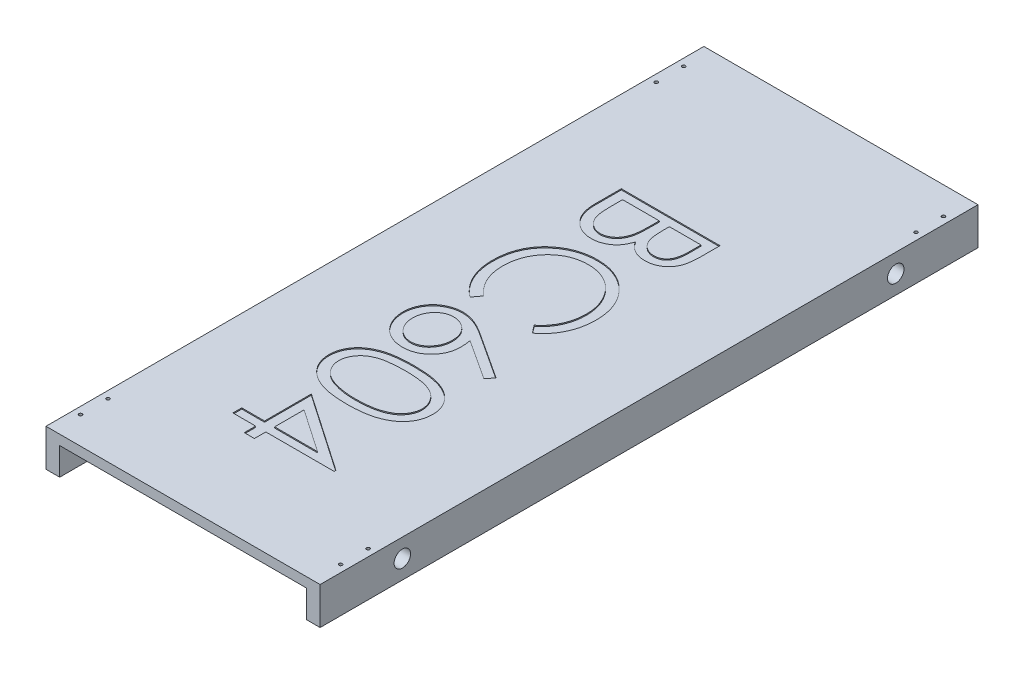
from build123d import *

# Parameters (mm, degrees)
BOSS_EXTRUDE1_DEPTH               = 1200
CUT_EXTRUDE1_DEPTH                = 1239.388983667
CUT_EXTRUDE1_DEPTH_BACK           = 1239.388983667
SKETCH4_R                         = 15
CUT_EXTRUDE2_DEPTH                = 1239.388983667
CUT_EXTRUDE2_DEPTH_BACK           = 1239.388983667
SKETCH4_3_R                       = 15
CUT_EXTRUDE3_DEPTH                = 2
CUT_EXTRUDE4_DEPTH                = 2
F_6_0_6_DIAMETER_HOLE1_AT_2_COUNT = 2
F_6_0_6_DIAMETER_HOLE1_AT_2_PITCH = 476.629835407
F_6_0_6_DIAMETER_HOLE1_AT_3_COUNT = 2
F_6_0_6_DIAMETER_HOLE1_AT_3_PITCH = 474
F_6_0_6_DIAMETER_HOLE1_AT_4_COUNT = 2
F_6_0_6_DIAMETER_HOLE1_AT_4_PITCH = 1151.627596978
F_6_0_6_DIAMETER_HOLE1_AT_5_COUNT = 2
F_6_0_6_DIAMETER_HOLE1_AT_5_PITCH = 1106.250609654
F_6_0_6_DIAMETER_HOLE1_AT_6_COUNT = 2
F_6_0_6_DIAMETER_HOLE1_AT_6_PITCH = 1050
F_6_0_6_DIAMETER_HOLE1_AT_7_COUNT = 2
F_6_0_6_DIAMETER_HOLE1_AT_7_PITCH = 1000
F_6_0_6_DIAMETER_HOLE1_AT_8_COUNT = 2
F_6_0_6_DIAMETER_HOLE1_AT_8_PITCH = 50


with BuildPart() as part:
    # Sketch2 → Boss-Extrude1 (new body)
    with BuildSketch(Plane.XY):
        Polygon((-251.282051282, 174.541128592), (248.717948718, 174.541128592), (248.717948718, 156.541128592), (248.717948718, 106.541128592), (223.717948718, 106.541128592), (223.717948718, 156.541128592), (-226.282051282, 156.541128592), (-226.282051282, 106.541128592), (-251.282051282, 106.541128592), (-251.282051282, 156.541128592), align=None)
    extrude(amount=BOSS_EXTRUDE1_DEPTH)

    # Sketch4 → Cut-Extrude1 (cut, two sides: drawn at the far end of the back side and taken through both)
    with BuildSketch(Plane(origin=(0, 0, 0), x_dir=(0, 0, -1), z_dir=(1, 0, 0)).offset(-CUT_EXTRUDE1_DEPTH_BACK)):
        with Locations((-1050, 140.541128592)):
            Circle(SKETCH4_R)
    extrude(amount=CUT_EXTRUDE1_DEPTH + CUT_EXTRUDE1_DEPTH_BACK, mode=Mode.SUBTRACT)

    # Sketch4<3> → Cut-Extrude2 (cut, two sides: drawn at the far end of the back side and taken through both)
    with BuildSketch(Plane(origin=(0, 0, 0), x_dir=(0, 0, -1), z_dir=(1, 0, 0)).offset(-CUT_EXTRUDE2_DEPTH_BACK)):
        with Locations((-150, 140.541128592)):
            Circle(SKETCH4_3_R)
    extrude(amount=CUT_EXTRUDE2_DEPTH + CUT_EXTRUDE2_DEPTH_BACK, mode=Mode.SUBTRACT)

    # Sketch10 → Cut-Extrude3 (cut)
    # profile 1 of 5: a face of its own
    with BuildSketch(Plane(origin=(0, 174.541128592, 0), x_dir=(1, 0, 0), z_dir=(0, 1, 0))):
        with BuildLine():
            Line((78.146190481, -300.04491907), (78.146190481, -335.165111378))
            add(Edge.make_bspline(
                [(78.146190481, -335.165111378), (78.137151889, -336.884290256), (78.119632848, -340.216486787), (77.84792896, -345.062058082), (77.477454509, -349.600568343), (76.889621173, -353.833333778), (76.180329777, -357.758398473), (75.321379235, -361.387591245), (74.291439104, -364.709371533), (72.653630355, -368.675169405), (70.219867411, -373.196803393), (66.623541204, -378.092720732), (62.224728815, -382.279224471), (57.262763679, -385.8888065), (51.80435256, -388.758578366), (45.97959428, -390.834713657), (39.863618981, -392.149118675), (35.664826976, -392.284295292), (33.542825096, -392.352611378)],
                knots=[0, 0, 0, 0, 1.001505555, 1.941167018, 2.826882275, 3.653841531, 4.429895133, 5.150066043, 5.825578002, 6.45369114, 7.647487171, 8.808567382, 9.977351308, 11.170798116, 12.373658725, 13.556498008, 14.765093433, 16, 16, 16, 16], degree=3))
            add(Edge.make_bspline(
                [(33.542825096, -392.352611378), (31.554642564, -392.297475334), (27.647676393, -392.189127808), (21.942511139, -391.117785689), (16.489305649, -389.522710094), (11.355286662, -387.20713163), (6.606437457, -384.228581148), (2.270980235, -380.644239428), (-1.546018812, -376.376612054), (-3.671033142, -373.174069448), (-4.750444135, -371.547322916)],
                knots=[0, 0, 0, 0, 1.044266239, 2.052081639, 3.041743201, 4.026043445, 5.00270663, 5.980942822, 6.97441044, 8, 8, 8, 8], degree=3))
            add(Edge.make_bspline(
                [(-4.750444135, -371.547322916), (-5.534895397, -373.592487364), (-7.035744986, -377.505393579), (-9.703667422, -382.8939412), (-12.572726976, -387.555154482), (-15.722466917, -391.494164039), (-19.160007854, -394.812170025), (-22.81651492, -397.791808261), (-26.872003078, -400.288077055), (-31.210995112, -402.432582364), (-35.803037831, -404.120285559), (-40.627130054, -405.314446312), (-45.629329694, -406.048199974), (-49.038837045, -406.148254614), (-50.760059519, -406.198765224)],
                knots=[0, 0, 0, 0, 1.272302504, 2.434229863, 3.488457646, 4.447234501, 5.35599188, 6.26022912, 7.18267843, 8.11661068, 9.06895546, 10.019249207, 11.000057067, 12, 12, 12, 12], degree=3))
            add(Edge.make_bspline(
                [(-50.760059519, -406.198765224), (-52.517202979, -406.148511661), (-55.974431963, -406.049636369), (-61.053409765, -405.320605874), (-65.906455435, -404.085024166), (-70.568074829, -402.387267407), (-75.01188155, -400.158891413), (-79.293530547, -397.505476298), (-83.298961583, -394.275933825), (-87.123428233, -390.676151579), (-90.560058808, -386.59901095), (-93.619614283, -382.200733576), (-96.147328006, -377.418057754), (-98.244128296, -372.325150131), (-99.869137809, -366.888168175), (-100.997294776, -361.127270907), (-101.75921832, -355.041206432), (-101.821744111, -350.864674882), (-101.853809519, -348.722803685)],
                knots=[0, 0, 0, 0, 0.978404568, 1.925038397, 2.85041836, 3.763147166, 4.682162379, 5.614488577, 6.562659439, 7.54271123, 8.535210642, 9.526693784, 10.520907202, 11.541451354, 12.589717429, 13.675358278, 14.807842563, 16, 16, 16, 16], degree=3))
            Line((-101.853809519, -348.722803685), (-101.853809519, -300.04491907))
            Line((-101.853809519, -300.04491907), (78.146190481, -300.04491907))
        make_face()
        with BuildLine():
            Line((59.684652019, -316.198765224), (1.992344327, -316.198765224))
            Line((1.992344327, -316.198765224), (1.992344327, -327.052130608))
            add(Edge.make_bspline(
                [(1.992344327, -327.052130608), (2.012740642, -328.63865437), (2.05215048, -331.704141593), (2.168599084, -336.155247993), (2.480381589, -340.276595815), (2.810143025, -344.082386479), (3.317908156, -347.547111925), (3.939270014, -350.682371106), (4.590672086, -353.516328478), (5.701591112, -356.783018278), (7.326766392, -360.487401204), (9.908212222, -364.411314459), (12.899379515, -367.926728046), (16.414448564, -370.862054075), (20.252125245, -373.284211145), (24.412751665, -374.90065365), (28.733898368, -376.047175078), (31.708191118, -376.147717563), (33.218305865, -376.198765224)],
                knots=[0, 0, 0, 0, 1.156481963, 2.23455883, 3.244418989, 4.168404366, 5.01828131, 5.794834307, 6.498111525, 7.13526334, 8.307595709, 9.435046769, 10.546766856, 11.659452936, 12.760769924, 13.837671619, 14.902137667, 16, 16, 16, 16], degree=3))
            add(Edge.make_bspline(
                [(33.218305865, -376.198765224), (34.217816075, -376.173234142), (36.178464499, -376.123152137), (39.025629028, -375.667346349), (41.737653684, -375.005967717), (44.25216376, -373.972692522), (46.640628838, -372.72324923), (48.796961191, -371.097950265), (50.839297556, -369.262436648), (52.692648407, -367.106804568), (54.353258025, -364.641491722), (55.814448831, -361.843008211), (56.967077926, -358.677938688), (58.001047584, -355.218047551), (58.718509843, -351.407962296), (59.318403841, -347.28491266), (59.623346562, -342.813921557), (59.663761065, -339.720753874), (59.684652019, -338.121842147)],
                knots=[0, 0, 0, 0, 0.911752476, 1.788502045, 2.626783689, 3.45400582, 4.26402138, 5.080402872, 5.911472738, 6.767166405, 7.66795952, 8.620018292, 9.640966946, 10.73819047, 11.913090943, 13.176185384, 14.540321519, 16, 16, 16, 16], degree=3))
            Line((59.684652019, -338.121842147), (59.684652019, -316.198765224))
        make_face(mode=Mode.SUBTRACT)
        with BuildLine():
            Line((-16.469194135, -316.198765224), (-83.392271058, -316.198765224))
            Line((-83.392271058, -316.198765224), (-83.392271058, -339.203572916))
            add(Edge.make_bspline(
                [(-83.392271058, -339.203572916), (-83.372604407, -340.850268699), (-83.33469953, -344.024057733), (-83.20960499, -348.606298043), (-82.931038039, -352.84187125), (-82.476899615, -356.733214658), (-82.005010221, -360.31458269), (-81.351892482, -363.550394358), (-80.60937658, -366.445610416), (-79.460298051, -369.802260223), (-77.678231305, -373.58449046), (-74.97375424, -377.657571628), (-71.79421265, -381.315031314), (-68.067907037, -384.385285533), (-64.046862306, -386.920581078), (-59.752109883, -388.698731772), (-55.31466984, -389.842057189), (-52.28131926, -389.977162316), (-50.760059519, -390.04491907)],
                knots=[0, 0, 0, 0, 1.159821618, 2.235403267, 3.228114831, 4.14795534, 4.994323282, 5.771256229, 6.471395042, 7.097801288, 8.267864287, 9.404187171, 10.531774336, 11.667624178, 12.792825787, 13.866573821, 14.930062559, 16, 16, 16, 16], degree=3))
            add(Edge.make_bspline(
                [(-50.760059519, -390.04491907), (-49.808850388, -390.0310698), (-47.921775214, -390.003594651), (-45.150755565, -389.573654821), (-42.454582343, -388.973860711), (-39.87402563, -388.105307285), (-37.367094245, -387.010131795), (-34.977455008, -385.635728108), (-32.647970771, -384.04855224), (-29.706360083, -381.565684728), (-26.315971326, -377.957718928), (-22.997023822, -372.829647938), (-20.320244429, -366.999155628), (-19.183704921, -362.770301313), (-18.596597981, -360.585784455)],
                knots=[0, 0, 0, 0, 0.723503378, 1.435336582, 2.130201219, 2.824764462, 3.504949994, 4.209866579, 4.920640069, 5.648298893, 7.13757748, 8.670694625, 10.280166878, 12, 12, 12, 12], degree=3))
            add(Edge.make_bspline(
                [(-18.596597981, -360.585784455), (-18.418896005, -359.7100032), (-18.033601468, -357.811128796), (-17.627149259, -354.714723215), (-17.262548395, -351.167882191), (-16.999933916, -347.185765547), (-16.718021857, -342.752535892), (-16.612287641, -337.869617446), (-16.483233445, -332.533558181), (-16.473993617, -328.831088783), (-16.469194135, -326.907899839)],
                knots=[0, 0, 0, 0, 0.634452549, 1.375623993, 2.216454381, 3.166361212, 4.209414599, 5.370755378, 6.634280627, 8, 8, 8, 8], degree=3))
            Line((-16.469194135, -326.907899839), (-16.469194135, -316.198765224))
        make_face(mode=Mode.SUBTRACT)
    # profile 2 of 5: a face of its own
    with BuildSketch(Plane(origin=(0, 174.541128592, 0), x_dir=(1, 0, 0), z_dir=(0, 1, 0))):
        with BuildLine():
            Line((45.117344327, -609.275688301), (34.300036634, -595.141072916))
            add(Edge.make_bspline(
                [(34.300036634, -595.141072916), (35.501715083, -594.132770086), (37.888870749, -592.129758535), (41.240961607, -588.907285263), (44.381460766, -585.548915057), (47.325328862, -582.05593168), (49.969619671, -578.365462678), (52.452133536, -574.566907318), (54.677331488, -570.596722136), (57.375427917, -565.106632925), (60.19094446, -557.924743585), (62.55168207, -548.883866147), (64.054485391, -539.446152511), (64.217248666, -533.007418816), (64.300036634, -529.73241907)],
                knots=[0, 0, 0, 0, 0.757959112, 1.505699292, 2.245454638, 2.979532153, 3.711538275, 4.438200793, 5.171680507, 5.909471876, 7.393775596, 8.890124382, 10.418191784, 12, 12, 12, 12], degree=3))
            add(Edge.make_bspline(
                [(64.300036634, -529.73241907), (64.279167677, -527.928157036), (64.237623446, -524.33637822), (63.693394735, -519.005561632), (62.919665439, -513.764191366), (61.799531636, -508.631758221), (60.34121905, -503.618452877), (58.631007645, -498.686103166), (56.502823112, -493.892799003), (54.15252742, -489.180854209), (51.497125227, -484.666703207), (48.601683077, -480.394635806), (45.494619312, -476.38416906), (42.183954184, -472.624189863), (38.628542794, -469.155934515), (34.870210343, -465.923819049), (30.863720628, -462.986093805), (26.684211993, -460.270569302), (22.325541372, -457.854238175), (17.815128438, -455.767619253), (13.170218131, -453.979213346), (8.381295054, -452.550972436), (3.467204783, -451.424429607), (-1.582481489, -450.646162626), (-6.757962051, -450.106829751), (-10.2658649, -450.065667685), (-12.034097981, -450.04491907)],
                knots=[0, 0, 0, 0, 1.055000685, 2.100209969, 3.131349012, 4.153242145, 5.170189196, 6.184191144, 7.204341339, 8.235672124, 9.263040994, 10.265373269, 11.252624173, 12.22887325, 13.193405896, 14.155809299, 15.126090485, 16.097288279, 17.069732292, 18.038585918, 19.002221264, 19.978698174, 20.959418239, 21.948869816, 22.966084182, 24, 24, 24, 24], degree=3))
            add(Edge.make_bspline(
                [(-12.034097981, -450.04491907), (-14.694565863, -450.10981262), (-19.918041655, -450.237222497), (-27.569101626, -451.371136821), (-34.898736277, -453.094255802), (-41.861128167, -455.676771187), (-48.542129439, -458.861179502), (-54.828699043, -462.884982379), (-60.815836646, -467.545261443), (-66.362045388, -472.907945873), (-71.428465546, -478.791673552), (-75.889924023, -485.104423291), (-79.608975122, -491.830472377), (-82.703738085, -498.895556216), (-85.082655508, -506.354042074), (-86.757381859, -514.192517627), (-87.849836859, -522.393934526), (-87.954426531, -527.998075091), (-88.007655673, -530.850207531)],
                knots=[0, 0, 0, 0, 1.029171465, 2.020641659, 2.987623507, 3.938342917, 4.889210282, 5.84687017, 6.821220943, 7.821438502, 8.827599549, 9.822697543, 10.807740252, 11.797342354, 12.80366471, 13.83203677, 14.896651826, 16, 16, 16, 16], degree=3))
            add(Edge.make_bspline(
                [(-88.007655673, -530.850207531), (-87.920804143, -533.992631537), (-87.749859555, -540.17767371), (-86.301669601, -549.24802935), (-83.953548112, -557.931011583), (-80.66736925, -566.227087462), (-76.395440158, -574.112869267), (-71.216692177, -581.600697511), (-65.081863635, -588.696892566), (-60.397588467, -592.963987081), (-58.007655673, -595.141072916)],
                knots=[0, 0, 0, 0, 1.028121516, 2.023589091, 2.998037872, 3.967518031, 4.937445131, 5.927275754, 6.942489185, 8, 8, 8, 8], degree=3))
            Line((-58.007655673, -595.141072916), (-68.716790289, -609.275688301))
            add(Edge.make_bspline(
                [(-68.716790289, -609.275688301), (-70.18448461, -608.138187017), (-73.112843081, -605.868633016), (-77.241065231, -602.193626891), (-81.12426891, -598.322306683), (-84.730315127, -594.225416046), (-88.134483836, -589.951953824), (-91.222653001, -585.426645115), (-94.088893191, -580.727650794), (-96.67865269, -575.827612616), (-99.000656278, -570.742618054), (-100.960955906, -565.477958976), (-102.673892145, -560.078237869), (-104.07378911, -554.540735401), (-105.168174621, -548.846952304), (-105.899350278, -543.016424078), (-106.40039593, -537.036843103), (-106.446055673, -533.00271115), (-106.469194135, -530.958380608)],
                knots=[0, 0, 0, 0, 0.986756325, 1.968786143, 2.935506311, 3.899499537, 4.868307269, 5.8376204, 6.809456583, 7.792545619, 8.781780509, 9.778496008, 10.776623214, 11.79151764, 12.812666265, 13.856269958, 14.913646641, 16, 16, 16, 16], degree=3))
            add(Edge.make_bspline(
                [(-106.469194135, -530.958380608), (-106.455720232, -529.022420588), (-106.429077257, -525.194299383), (-105.997480076, -519.542363586), (-105.408636464, -514.040042288), (-104.522001152, -508.703061529), (-103.475720806, -503.502297098), (-102.073199037, -498.48489561), (-100.502099041, -493.601484791), (-98.655556865, -488.871684413), (-96.571867478, -484.29147128), (-94.21687302, -479.875618124), (-91.610377123, -475.626155887), (-88.80983373, -471.501305671), (-85.725286776, -467.562001368), (-82.399574145, -463.774105779), (-78.84390502, -460.11637843), (-76.279941134, -457.853383201), (-74.99082875, -456.715592147)],
                knots=[0, 0, 0, 0, 1.114604814, 2.203992996, 3.262667896, 4.300477797, 5.318619304, 6.316056647, 7.298880507, 8.271930387, 9.238335007, 10.195173496, 11.151986948, 12.108099108, 13.064862484, 14.031167946, 15.010108607, 16, 16, 16, 16], degree=3))
            add(Edge.make_bspline(
                [(-74.99082875, -456.715592147), (-72.751567606, -454.893187624), (-68.300079642, -451.270380244), (-61.085372034, -446.63534509), (-53.552721292, -442.667756537), (-45.662553526, -439.459852039), (-37.432573611, -436.952054334), (-28.85863287, -435.21473573), (-19.9487387, -434.085796071), (-13.888560997, -433.956695506), (-10.808136442, -433.891072916)],
                knots=[0, 0, 0, 0, 0.994628077, 1.977248131, 2.950237994, 3.925870899, 4.908910175, 5.911660606, 6.938484602, 8, 8, 8, 8], degree=3))
            add(Edge.make_bspline(
                [(-10.808136442, -433.891072916), (-7.570562862, -433.971412034), (-1.200838964, -434.129474233), (8.149469143, -435.461295021), (17.094834897, -437.629756552), (25.669677939, -440.61574253), (33.824936266, -444.555056397), (41.595052984, -449.323914415), (48.973683569, -454.968896804), (55.866491537, -461.419107975), (62.168347484, -468.494372232), (67.712710432, -476.070670924), (72.326742537, -484.133768177), (76.183691139, -492.594679369), (79.148262686, -501.516802008), (81.223569662, -510.881089047), (82.515307007, -520.669947664), (82.678603422, -527.348586678), (82.761575096, -530.742034455)],
                knots=[0, 0, 0, 0, 1.032901378, 2.032168977, 3.007206631, 3.966850309, 4.924221947, 5.891988639, 6.871730993, 7.884084801, 8.900290346, 9.89161143, 10.874607481, 11.860025555, 12.854717796, 13.869097222, 14.917278314, 16, 16, 16, 16], degree=3))
            add(Edge.make_bspline(
                [(82.761575096, -530.742034455), (82.736797947, -532.81021135), (82.687754075, -536.903959231), (82.208883891, -542.959751189), (81.412028747, -548.855858238), (80.320283323, -554.606539297), (78.982169408, -560.232647513), (77.230474882, -565.67646323), (75.196328111, -570.967630063), (72.913290121, -576.110110809), (70.303254603, -581.047956815), (67.468482434, -585.780269476), (64.3435376, -590.249962094), (61.031730866, -594.541109885), (57.409178914, -598.557105531), (53.593852962, -602.412644874), (49.472538922, -605.974543062), (46.571733337, -608.173292242), (45.117344327, -609.275688301)],
                knots=[0, 0, 0, 0, 1.096705196, 2.170817488, 3.219277236, 4.250701065, 5.274195539, 6.284202015, 7.28098643, 8.279664616, 9.266225751, 10.241373748, 11.203306326, 12.157093976, 13.114198862, 14.069774147, 15.032234603, 16, 16, 16, 16], degree=3))
        make_face()
    # profile 3 of 5: a face of its own
    with BuildSketch(Plane(origin=(0, 174.541128592, 0), x_dir=(1, 0, 0), z_dir=(0, 1, 0))):
        with BuildLine():
            Line((82.761575096, -713.121842147), (72.989940481, -725.561745993))
            Line((72.989940481, -725.561745993), (0.261575096, -678.001649839))
            add(Edge.make_bspline(
                [(0.261575096, -678.001649839), (0.76628793, -681.168121227), (1.750787378, -687.34468169), (1.913196001, -693.596642185), (1.992344327, -696.643476762)],
                knots=[0, 0, 0, 0, 1.025318673, 2, 2, 2, 2], degree=3))
            add(Edge.make_bspline(
                [(1.992344327, -696.643476762), (1.943172868, -698.472919431), (1.846380315, -702.074122883), (1.101496565, -707.361329852), (-0.072366334, -712.441903702), (-1.783510925, -717.294786618), (-3.969346293, -721.937397114), (-6.589059621, -726.396377485), (-9.777923182, -730.587909433), (-13.340120908, -734.565970078), (-17.285565825, -738.177649373), (-21.471920285, -741.375275087), (-25.894822736, -744.061224376), (-30.552032984, -746.240454631), (-35.436372047, -747.93270553), (-40.541590649, -749.166355847), (-45.871209181, -749.895592049), (-49.495801052, -749.994617286), (-51.336982596, -750.04491907)],
                knots=[0, 0, 0, 0, 1.04369286, 2.054478336, 3.041073146, 4.015093852, 4.984733326, 5.965804835, 6.960378782, 7.985147595, 9.009457201, 10.008161701, 10.986880575, 11.956520048, 12.937015923, 13.931873656, 14.949455224, 16, 16, 16, 16], degree=3))
            add(Edge.make_bspline(
                [(-51.336982596, -750.04491907), (-53.854441391, -749.95098331), (-58.805283657, -749.766248952), (-66.046293554, -748.421461292), (-72.88928098, -746.100658257), (-79.361137747, -742.995702095), (-85.273564803, -738.967265621), (-90.616813447, -734.193346918), (-95.274239575, -728.628819109), (-99.269651438, -722.405451441), (-102.444001132, -715.669834905), (-104.790862653, -708.607320642), (-106.193172054, -701.278275212), (-106.376763565, -696.30084495), (-106.469194135, -693.79491907)],
                knots=[0, 0, 0, 0, 1.031881447, 2.029301251, 3.006342947, 3.987068354, 4.962916383, 5.929513747, 6.915671209, 7.928552063, 8.953527267, 9.960179832, 10.973036711, 12, 12, 12, 12], degree=3))
            add(Edge.make_bspline(
                [(-106.469194135, -693.79491907), (-106.390600895, -691.372802569), (-106.234921447, -686.575013861), (-104.848098883, -679.517334131), (-102.600316013, -672.735781665), (-99.503540328, -666.27802514), (-95.592145916, -660.295460062), (-90.882661509, -654.944848052), (-85.479172119, -650.244805011), (-79.365101818, -646.35400093), (-72.83744487, -643.182985044), (-65.968931821, -640.946421684), (-58.897794221, -639.500030322), (-54.084387944, -639.350803448), (-51.661501827, -639.275688301)],
                knots=[0, 0, 0, 0, 1.011913813, 2.004424092, 2.994488568, 3.992479987, 4.990471406, 5.973328987, 6.963763268, 7.974390938, 8.994854117, 9.989689954, 10.988086187, 12, 12, 12, 12], degree=3))
            add(Edge.make_bspline(
                [(-51.661501827, -639.275688301), (-49.808455351, -639.340922785), (-46.026572179, -639.474059865), (-40.282235291, -640.268606622), (-34.427577709, -641.72590245), (-29.464429832, -643.303015046), (-25.354044175, -644.86798682), (-22.108181202, -646.319064658), (-18.680445681, -647.94154649), (-15.135693741, -649.843321145), (-11.37264414, -651.859355753), (-7.530654094, -654.214312954), (-3.469402263, -656.67174698), (-0.765483878, -658.4720005), (0.622152019, -659.395880608)],
                knots=[0, 0, 0, 0, 1.17367173, 2.395347028, 3.66355231, 4.98980831, 5.690886799, 6.447442954, 7.240630024, 8.091733897, 8.994365608, 9.943299771, 10.944512865, 12, 12, 12, 12], degree=3))
            Line((0.622152019, -659.395880608), (82.761575096, -713.121842147))
        make_face()
        with BuildLine():
            add(Edge.make_bspline(
                [(-16.469194135, -693.254053685), (-16.509737869, -691.882895545), (-16.589284343, -689.192694566), (-17.038563397, -685.25075982), (-17.889824031, -681.530047777), (-18.990949258, -677.988061839), (-20.490208306, -674.661718798), (-22.289744211, -671.513074962), (-24.429274764, -668.573374009), (-26.884944724, -665.894242185), (-29.534275238, -663.434137493), (-32.388946086, -661.318045724), (-35.361742084, -659.490714391), (-38.480603906, -658.005486306), (-41.743530923, -656.848820911), (-45.135730626, -656.012176957), (-48.679892316, -655.546553053), (-51.083278534, -655.469090052), (-52.310540289, -655.429534455)],
                knots=[0, 0, 0, 0, 1.129474985, 2.216020618, 3.260639938, 4.268601163, 5.26556745, 6.258792394, 7.250684778, 8.252748164, 9.247500881, 10.223461414, 11.174097059, 12.117127289, 13.062595836, 14.020469732, 14.98917545, 16, 16, 16, 16], degree=3))
            add(Edge.make_bspline(
                [(-52.310540289, -655.429534455), (-53.526778671, -655.461830331), (-55.911641077, -655.525157738), (-59.426888127, -656.097521169), (-62.806605357, -656.978053767), (-66.053264721, -658.266920178), (-69.149156201, -659.883535512), (-72.116270817, -661.872958936), (-74.956656542, -664.201504707), (-77.598688928, -666.908392964), (-80.022025237, -669.827509512), (-82.179768436, -672.914668609), (-83.991695737, -676.160054287), (-85.424167087, -679.582185027), (-86.597395272, -683.133148326), (-87.423577166, -686.840033285), (-87.890531563, -690.706096954), (-87.968101887, -693.32493519), (-88.007655673, -694.660303685)],
                knots=[0, 0, 0, 0, 0.989642335, 1.94054129, 2.892446913, 3.828371744, 4.778262963, 5.730973156, 6.732161388, 7.763274768, 8.805796303, 9.818398792, 10.825975928, 11.825728216, 12.834635236, 13.867465554, 14.912602056, 16, 16, 16, 16], degree=3))
            add(Edge.make_bspline(
                [(-88.007655673, -694.660303685), (-87.968104988, -695.995674368), (-87.890540746, -698.614516895), (-87.423542266, -702.480549465), (-86.597523333, -706.187549388), (-85.423702866, -709.738094849), (-83.993417846, -713.161767984), (-82.168414642, -716.409994491), (-80.035144462, -719.526627763), (-77.594518075, -722.443829287), (-74.971585259, -725.162031579), (-72.090553083, -727.436037707), (-69.172738401, -729.488311523), (-66.04092776, -731.0428372), (-62.808559822, -732.346057558), (-59.426364533, -733.222147506), (-55.911778155, -733.795695385), (-53.526824968, -733.85886004), (-52.310540289, -733.891072916)],
                knots=[0, 0, 0, 0, 1.087205562, 2.132157158, 3.164804748, 4.173533273, 5.173108684, 6.180507559, 7.20098426, 8.243321352, 9.274252308, 10.269075238, 11.227079059, 12.172305571, 13.108064818, 14.05980203, 15.010532752, 16, 16, 16, 16], degree=3))
            add(Edge.make_bspline(
                [(-52.310540289, -733.891072916), (-51.081535035, -733.863101991), (-48.669397415, -733.808204161), (-45.138923783, -733.175255155), (-41.715946735, -732.320352182), (-38.477574352, -730.938750621), (-35.334252612, -729.29315039), (-32.375819999, -727.196763794), (-29.518463585, -724.79320525), (-26.867373938, -722.009651234), (-24.442471578, -718.981393652), (-22.302088874, -715.761062401), (-20.495647916, -712.392107515), (-18.98842914, -708.877783371), (-17.900740913, -705.177865623), (-17.044288683, -701.35207622), (-16.588527698, -697.351486743), (-16.509478643, -694.637261153), (-16.469194135, -693.254053685)],
                knots=[0, 0, 0, 0, 0.978265087, 1.920016216, 2.851775529, 3.783928695, 4.718195979, 5.674835085, 6.667117013, 7.690134047, 8.732874136, 9.755756613, 10.767227014, 11.776017537, 12.797239016, 13.836276431, 14.897336092, 16, 16, 16, 16], degree=3))
        make_face(mode=Mode.SUBTRACT)
    # profile 4 of 5: a face of its own
    with BuildSketch(Plane(origin=(0, 174.541128592, 0), x_dir=(1, 0, 0), z_dir=(0, 1, 0))):
        with BuildLine():
            add(Edge.make_bspline(
                [(-11.925924904, -768.506457531), (-9.040916391, -768.523327036), (-3.436745771, -768.556096291), (4.729321525, -768.920643665), (12.390136423, -769.52623266), (19.546065414, -770.356154823), (26.198956564, -771.366107651), (32.33102843, -772.71433416), (37.970669891, -774.247559035), (43.136245665, -776.024558682), (47.897437335, -778.029587397), (52.341976272, -780.212123857), (56.464219827, -782.657593297), (60.326095078, -785.23040845), (63.884501668, -788.024586816), (67.132700833, -791.010656681), (70.0726539, -794.21823868), (72.739351299, -797.583894131), (75.062384683, -801.128893032), (77.155592175, -804.743954903), (78.873615561, -808.492870426), (80.285279434, -812.341448317), (81.416409924, -816.278496493), (82.199715599, -820.32028254), (82.690637684, -824.467782892), (82.737704951, -827.267082398), (82.761575096, -828.686745993)],
                knots=[0, 0, 0, 0, 1.646377244, 3.198111528, 4.663803227, 6.031090796, 7.308794487, 8.502186765, 9.612154809, 10.642545331, 11.617106989, 12.558866172, 13.465886467, 14.35053239, 15.20542558, 16.045215227, 16.865619885, 17.686225247, 18.492864914, 19.282407821, 20.068097601, 20.842842034, 21.620163247, 22.403093475, 23.190129512, 24, 24, 24, 24], degree=3))
            add(Edge.make_bspline(
                [(82.761575096, -828.686745993), (82.736487458, -830.118284887), (82.68659604, -832.965165344), (82.207078996, -837.174098928), (81.411421237, -841.285796845), (80.284056829, -845.282729692), (78.88542203, -849.197728996), (77.132370293, -853.000172818), (75.091742829, -856.713679874), (72.693943425, -860.279237518), (70.020569221, -863.735989164), (66.998489111, -866.99902726), (63.658217834, -870.068648821), (60.035493406, -872.983378812), (56.0608319, -875.660523811), (51.803363395, -878.210014611), (47.188633206, -880.492005029), (42.293637717, -882.689788324), (36.982935264, -884.586833356), (31.286461866, -886.297668827), (25.136932256, -887.680015783), (18.56661107, -888.831464074), (11.551369074, -889.723487295), (4.106244277, -890.37316603), (-3.773661528, -890.716353261), (-9.161208057, -890.780983608), (-11.925924904, -890.814149839)],
                knots=[0, 0, 0, 0, 0.810914788, 1.612654377, 2.396697861, 3.181598691, 3.963628158, 4.749916497, 5.551656086, 6.361998678, 7.18212741, 8.025565596, 8.878627764, 9.750805457, 10.657531673, 11.591944965, 12.560506719, 13.57287815, 14.630710178, 15.753379473, 16.941251878, 18.199788006, 19.531962791, 20.947069417, 22.433333509, 24, 24, 24, 24], degree=3))
            add(Edge.make_bspline(
                [(-11.925924904, -890.814149839), (-14.678572734, -890.78059836), (-20.041994776, -890.715224672), (-27.88658713, -890.377463381), (-35.291701215, -889.709009198), (-42.27795005, -888.882236851), (-48.803854028, -887.704511036), (-54.931466603, -886.365644343), (-60.607907463, -884.701576773), (-65.890601706, -882.830388541), (-70.761614884, -880.680294965), (-75.336452911, -878.378135978), (-79.590447486, -875.844294475), (-83.565051212, -873.151183586), (-87.21919408, -870.261228446), (-90.561907153, -867.178608848), (-93.590985617, -863.900978433), (-96.300886497, -860.436411441), (-98.670773835, -856.814762553), (-100.789071936, -853.113650734), (-102.507939476, -849.259205087), (-103.959212673, -845.337087579), (-105.089170627, -841.310290462), (-105.862845211, -837.182763485), (-106.406956554, -832.968024142), (-106.44837644, -830.118780159), (-106.469194135, -828.686745993)],
                knots=[0, 0, 0, 0, 1.56130642, 3.042141888, 4.451772327, 5.777565838, 7.030558081, 8.211376819, 9.333164717, 10.383253789, 11.387583522, 12.350962576, 13.286244149, 14.193812918, 15.072134482, 15.925989337, 16.770211267, 17.600669898, 18.417446232, 19.22325363, 20.01647746, 20.807971184, 21.593601364, 22.38506573, 23.188331689, 24, 24, 24, 24], degree=3))
            add(Edge.make_bspline(
                [(-106.469194135, -828.686745993), (-106.44509429, -827.267140074), (-106.397574101, -824.467954292), (-105.909969827, -820.31962087), (-105.114851547, -816.284138394), (-104.035084871, -812.353439645), (-102.662765453, -808.519480354), (-100.917225991, -804.819817947), (-98.892671765, -801.205592615), (-96.589362463, -797.693296161), (-93.949829984, -794.349870878), (-91.030585459, -791.156160873), (-87.758408291, -788.192806105), (-84.18567468, -785.4336477), (-80.342699297, -782.81535619), (-76.191625944, -780.393850568), (-71.705444309, -778.215571245), (-66.917969363, -776.165608174), (-61.714429194, -774.358569602), (-56.0447082, -772.774417021), (-49.877442839, -771.453804236), (-43.230941874, -770.391760598), (-36.100230665, -769.516212462), (-28.472754207, -768.923511203), (-20.355093279, -768.555805968), (-14.786920331, -768.523207185), (-11.925924904, -768.506457531)],
                knots=[0, 0, 0, 0, 0.810940842, 1.599017053, 2.38298203, 3.159479784, 3.926441347, 4.70693857, 5.494146311, 6.292334103, 7.104379492, 7.925868426, 8.762126819, 9.623561095, 10.503686106, 11.41783325, 12.366995289, 13.351843594, 14.392337808, 15.512229747, 16.713911458, 17.994391108, 19.357476964, 20.818259213, 22.365182633, 24, 24, 24, 24], degree=3))
        make_face()
        with BuildLine():
            add(Edge.make_bspline(
                [(-11.853809519, -784.660303685), (-14.258028316, -784.666446676), (-18.924144907, -784.678369016), (-25.70465546, -784.989830773), (-32.028843838, -785.414128375), (-37.90473987, -785.961395232), (-43.312455232, -786.774117817), (-48.289180352, -787.68475422), (-52.808585839, -788.792936426), (-56.901657683, -790.104126113), (-60.637948534, -791.597506286), (-64.114397163, -793.228300001), (-67.373152545, -794.979263675), (-70.38111652, -796.942279638), (-73.168231252, -799.072822435), (-75.726487311, -801.374390574), (-78.044722407, -803.842936279), (-80.795533111, -807.260212746), (-83.671753533, -811.749436862), (-86.145522694, -817.434702666), (-87.710189638, -823.279116814), (-87.908615283, -827.247078629), (-88.007655673, -829.227611378)],
                knots=[0, 0, 0, 0, 1.459116078, 2.831857795, 4.118796693, 5.306371758, 6.412361096, 7.436813035, 8.376339383, 9.234574298, 10.043323891, 10.816788787, 11.564361537, 12.286735248, 12.994408768, 13.691741332, 14.372975427, 15.047457468, 16.352811911, 17.594285292, 18.799233213, 20, 20, 20, 20], degree=3))
            add(Edge.make_bspline(
                [(-88.007655673, -829.227611378), (-87.925484089, -831.220863063), (-87.761310573, -835.203251112), (-86.177375508, -841.021560577), (-83.787513479, -846.669974467), (-80.961641771, -851.096531395), (-78.270470542, -854.464205061), (-75.976002915, -856.877078838), (-73.406844025, -859.091698472), (-70.634880235, -861.192148036), (-67.607152477, -863.118614785), (-64.338220035, -864.870433295), (-60.819005171, -866.469005454), (-58.362275731, -867.379756389), (-57.106213366, -867.845399839)],
                knots=[0, 0, 0, 0, 1.353760809, 2.704726607, 4.075137775, 5.516104923, 6.260822281, 7.007110065, 7.778089737, 8.566572457, 9.372053459, 10.217411131, 11.088608312, 12, 12, 12, 12], degree=3))
            add(Edge.make_bspline(
                [(-57.106213366, -867.845399839), (-55.500112479, -868.388062183), (-52.239038889, -869.489899466), (-47.180336782, -870.909933571), (-41.872766065, -872.028268387), (-36.348045777, -873.03438434), (-30.565432582, -873.721112929), (-24.542818552, -874.273857612), (-18.27566278, -874.599435798), (-14.017634661, -874.639794424), (-11.853809519, -874.660303685)],
                knots=[0, 0, 0, 0, 0.884706709, 1.796334032, 2.740027952, 3.714592787, 4.726048262, 5.777819803, 6.87074269, 8, 8, 8, 8], degree=3))
            add(Edge.make_bspline(
                [(-11.853809519, -874.660303685), (-9.690030886, -874.637684164), (-5.456693722, -874.593430072), (0.736682382, -874.302676682), (6.629334243, -873.835460148), (12.226607516, -873.20309282), (17.518539692, -872.334986204), (22.512703426, -871.292476564), (27.207752376, -870.070253629), (31.615794644, -868.668327487), (35.720986568, -867.088376131), (39.532265954, -865.343003615), (43.069837943, -863.480454656), (46.323548345, -861.457068118), (49.308083659, -859.297308079), (51.96357594, -856.944058129), (54.372334592, -854.490691537), (57.121838056, -851.054378765), (59.925296723, -846.555701171), (62.505250075, -840.957924972), (63.986819413, -835.132577566), (64.195706174, -831.194514211), (64.300036634, -829.227611378)],
                knots=[0, 0, 0, 0, 1.313668642, 2.570134578, 3.763346207, 4.902004944, 5.98888779, 7.017888835, 7.998425394, 8.933058446, 9.82474457, 10.667209444, 11.476765193, 12.250262638, 12.991704352, 13.7104269, 14.401925311, 15.076585796, 16.378385137, 17.609787933, 18.806186071, 20, 20, 20, 20], degree=3))
            add(Edge.make_bspline(
                [(64.300036634, -829.227611378), (64.195696834, -827.236697333), (63.986827151, -823.251242276), (62.50913513, -817.366613796), (59.949316687, -811.728961994), (57.103734259, -807.266376862), (54.421008556, -803.834399649), (52.088100096, -801.410944589), (49.522104894, -799.145266442), (46.746790103, -797.012948645), (43.73730903, -795.051822374), (40.479027541, -793.300142124), (37.002255851, -791.670284519), (33.266815077, -790.173698155), (29.167572687, -788.874659777), (24.670976176, -787.713559092), (19.689602592, -786.803475164), (14.266768716, -786.00929738), (8.383649337, -785.403781863), (2.04488074, -784.990919991), (-4.747355464, -784.677805475), (-9.437547301, -784.666254461), (-11.853809519, -784.660303685)],
                knots=[0, 0, 0, 0, 1.207964612, 2.418129846, 3.655795183, 4.951004962, 5.620895151, 6.296795572, 6.989224116, 7.696855977, 8.419187164, 9.166715907, 9.940135271, 10.748837255, 11.607021648, 12.548275234, 13.5654991, 14.678641405, 15.874140913, 17.15372626, 18.533675393, 20, 20, 20, 20], degree=3))
        make_face(mode=Mode.SUBTRACT)
    # profile 5 of 5: a face of its own
    with BuildSketch(Plane(origin=(0, 174.541128592, 0), x_dir=(1, 0, 0), z_dir=(0, 1, 0))):
        Polygon((82.761575096, -1005.225207531), (82.761575096, -1008.506457531), (-41.853809519, -1008.506457531), (-41.853809519, -1029.275688301), (-60.315347981, -1029.275688301), (-60.315347981, -1008.506457531), (-101.853809519, -1008.506457531), (-101.853809519, -992.352611378), (-60.315347981, -992.352611378), (-60.315347981, -906.967995993), align=None)
        Polygon((-41.853809519, -992.352611378), (36.319267404, -992.352611378), (-41.853809519, -938.698765224), align=None, mode=Mode.SUBTRACT)
    extrude(amount=-CUT_EXTRUDE3_DEPTH, mode=Mode.SUBTRACT)

    # Sketch12 → Cut-Extrude4 (cut)
    # profile 1 of 5: a face of its own
    with BuildSketch(Plane(origin=(0, 156.541128592, 0), x_dir=(-1, 0, 0), z_dir=(0, -1, 0))):
        with BuildLine():
            Line((-85.454847818, -978.891072916), (-85.454847818, -943.770880608))
            add(Edge.make_bspline(
                [(-85.454847818, -943.770880608), (-85.44595152, -942.051674618), (-85.428708281, -938.719425535), (-85.155070578, -933.874222708), (-84.791295139, -929.334436023), (-84.181081405, -925.108087846), (-83.548370259, -921.167677966), (-82.619701769, -917.553209815), (-81.593953575, -914.234407732), (-80.015700782, -910.249205728), (-77.564654301, -905.727447989), (-73.929519454, -900.867404502), (-69.571286314, -896.642758161), (-64.604735877, -893.050556519), (-59.140967593, -890.167738277), (-53.297536193, -888.108531358), (-47.172750419, -886.78561841), (-42.973643477, -886.651275402), (-40.851482434, -886.583380608)],
                knots=[0, 0, 0, 0, 1.00128172, 1.940733171, 2.826250472, 3.653024905, 4.427672124, 5.149348099, 5.824709082, 6.450061444, 7.643590664, 8.808605388, 9.972104426, 11.165284501, 12.367876273, 13.557044126, 14.765369432, 16, 16, 16, 16], degree=3))
            add(Edge.make_bspline(
                [(-40.851482434, -886.583380608), (-38.863724116, -886.639932017), (-34.957591566, -886.751060868), (-29.254274051, -887.800767915), (-23.830752496, -889.466803023), (-18.691668625, -891.769330747), (-13.932686923, -894.736008886), (-9.568549432, -898.290506303), (-5.764196531, -902.561206545), (-3.63814901, -905.762537833), (-2.558213203, -907.38866907)],
                knots=[0, 0, 0, 0, 1.044641374, 2.052818814, 3.038628718, 4.023282556, 5.005660861, 5.98021751, 6.974042014, 8, 8, 8, 8], degree=3))
            add(Edge.make_bspline(
                [(-2.558213203, -907.38866907), (-1.772901907, -905.34404453), (-0.270406862, -901.432171295), (2.381833299, -896.045757577), (5.277006963, -891.421943967), (8.389835748, -887.470406608), (11.794619514, -884.10867118), (15.519020577, -881.197213907), (19.559989905, -878.680202365), (23.902675675, -876.53824295), (28.510262949, -874.855707122), (33.326474604, -873.619066606), (38.332847694, -872.887566864), (41.730272726, -872.787779077), (43.451402182, -872.737226762)],
                knots=[0, 0, 0, 0, 1.272586185, 2.434772614, 3.483318042, 4.437947805, 5.351807173, 6.25737843, 7.180033415, 8.1141739, 9.066731021, 10.025721652, 10.999834114, 12, 12, 12, 12], degree=3))
            add(Edge.make_bspline(
                [(43.451402182, -872.737226762), (45.208562756, -872.787453577), (48.665825414, -872.886276241), (53.744558771, -873.615688776), (58.598502812, -874.849866428), (63.256816896, -876.552789029), (67.709734175, -878.760060175), (71.94112322, -881.485059962), (75.959787375, -884.689534859), (79.772819097, -888.311109465), (83.261862982, -892.347071037), (86.261264092, -896.794960459), (88.840321583, -901.532927216), (90.940098226, -906.621541722), (92.560074506, -912.047813775), (93.6887524, -917.808723921), (94.450529936, -923.894784786), (94.513076249, -928.071316844), (94.545152182, -930.213188301)],
                knots=[0, 0, 0, 0, 0.978680899, 1.925582087, 2.851223405, 3.764209995, 4.683484765, 5.614004905, 6.562443559, 7.542772147, 8.539900013, 9.527881485, 10.525548727, 11.540192123, 12.58875426, 13.674701727, 14.807505862, 16, 16, 16, 16], degree=3))
            Line((94.545152182, -930.213188301), (94.545152182, -978.891072916))
            Line((94.545152182, -978.891072916), (-85.454847818, -978.891072916))
        make_face()
        with BuildLine():
            Line((-66.993309357, -962.737226762), (-9.301001664, -962.737226762))
            Line((-9.301001664, -962.737226762), (-9.301001664, -951.883861378))
            add(Edge.make_bspline(
                [(-9.301001664, -951.883861378), (-9.32156913, -950.297351898), (-9.361309666, -947.231892273), (-9.475147726, -942.792583353), (-9.793904109, -938.671867974), (-10.112569467, -934.876859942), (-10.630689649, -931.413532543), (-11.247432211, -928.289568122), (-11.899680328, -925.455907873), (-13.009033976, -922.188236319), (-14.648011163, -918.481108483), (-17.19403939, -914.531742258), (-20.224134442, -911.033888878), (-23.753148532, -908.115569325), (-27.596865413, -905.706060824), (-31.721540855, -904.018124345), (-36.044171102, -902.892827344), (-39.017392437, -902.789624929), (-40.526963203, -902.737226762)],
                knots=[0, 0, 0, 0, 1.156917035, 2.235399477, 3.236897345, 4.169954739, 5.01148057, 5.788325709, 6.491867502, 7.129259015, 8.302032419, 9.437271567, 10.542795419, 11.662606952, 12.764338259, 13.836858145, 14.901724648, 16, 16, 16, 16], degree=3))
            add(Edge.make_bspline(
                [(-40.526963203, -902.737226762), (-41.526133845, -902.76383133), (-43.486116168, -902.816019096), (-46.35260038, -903.258964298), (-49.04604414, -903.976653102), (-51.592297724, -904.948597204), (-53.928080647, -906.27641709), (-56.165002634, -907.81553478), (-58.169083009, -909.715794094), (-60.036805999, -911.863255832), (-61.708411829, -914.320335081), (-63.093078179, -917.13996966), (-64.34804596, -920.249267712), (-65.277061293, -923.732586191), (-66.093984625, -927.51774955), (-66.607263028, -931.656010307), (-66.937562552, -936.121145171), (-66.974312615, -939.214922814), (-66.993309357, -940.814149839)],
                knots=[0, 0, 0, 0, 0.911708768, 1.788416306, 2.640049961, 3.452993646, 4.268229297, 5.087074648, 5.92553149, 6.781184137, 7.681934069, 8.628939405, 9.643570426, 10.73771997, 11.914765019, 13.176320755, 14.540391495, 16, 16, 16, 16], degree=3))
            Line((-66.993309357, -940.814149839), (-66.993309357, -962.737226762))
        make_face(mode=Mode.SUBTRACT)
        with BuildLine():
            Line((9.160536797, -962.737226762), (76.08361372, -962.737226762))
            Line((76.08361372, -962.737226762), (76.08361372, -939.73241907))
            add(Edge.make_bspline(
                [(76.08361372, -939.73241907), (76.061915758, -938.085903675), (76.020095797, -934.912462316), (75.922019298, -930.326949948), (75.551010796, -926.087979492), (75.208757126, -922.182178523), (74.623518052, -918.619913064), (74.071204524, -915.373781953), (73.251334551, -912.497072676), (72.12451973, -909.130657273), (70.320629091, -905.367782954), (67.685161893, -901.255638635), (64.432588515, -897.66991252), (60.733402283, -894.591901383), (56.722355565, -892.05179292), (52.451885133, -890.229024828), (48.00504352, -889.096291733), (44.972338278, -888.959616897), (43.451402182, -888.891072916)],
                knots=[0, 0, 0, 0, 1.160376723, 2.23647316, 3.230273494, 4.158083346, 4.997711197, 5.773399541, 6.476071462, 7.102777513, 8.27340052, 9.405620712, 10.53304798, 11.669441455, 12.787990954, 13.865552736, 14.929550474, 16, 16, 16, 16], degree=3))
            add(Edge.make_bspline(
                [(43.451402182, -888.891072916), (42.500295614, -888.905229082), (40.613423912, -888.933313073), (37.840908994, -889.358778677), (35.153903596, -889.974292564), (32.541210537, -890.784942067), (30.046758826, -891.91818637), (27.660982199, -893.307448905), (25.335819963, -894.89770671), (22.358248308, -897.351173709), (18.970184794, -900.971865102), (15.694035488, -906.11727162), (13.009262852, -911.93547799), (11.874255903, -916.165227987), (11.287940643, -918.350207531)],
                knots=[0, 0, 0, 0, 0.723302347, 1.434937762, 2.129609326, 2.821140842, 3.513216847, 4.209993937, 4.920569932, 5.655069131, 7.14393391, 8.6716197, 10.280644748, 12, 12, 12, 12], degree=3))
            add(Edge.make_bspline(
                [(11.287940643, -918.350207531), (11.110250611, -919.225989604), (10.72498197, -921.124865782), (10.318300082, -924.221255632), (9.955982716, -927.756243176), (9.687980322, -931.737991148), (9.410958082, -936.171537262), (9.303224424, -941.066350223), (9.174691048, -946.402440691), (9.165375573, -950.104905557), (9.160536797, -952.028092147)],
                knots=[0, 0, 0, 0, 0.634451884, 1.375622551, 2.216452059, 3.157844607, 4.20941857, 5.370758133, 6.634282058, 8, 8, 8, 8], degree=3))
            Line((9.160536797, -952.028092147), (9.160536797, -962.737226762))
        make_face(mode=Mode.SUBTRACT)
    # profile 2 of 5: a face of its own
    with BuildSketch(Plane(origin=(0, 156.541128592, 0), x_dir=(-1, 0, 0), z_dir=(0, -1, 0))):
        with BuildLine():
            Line((-52.426001664, -669.660303685), (-41.608693972, -683.79491907))
            add(Edge.make_bspline(
                [(-41.608693972, -683.79491907), (-42.810356523, -684.803232239), (-45.197480608, -686.80626433), (-48.549805046, -690.028585685), (-51.689430467, -693.387524163), (-54.636529403, -696.878406227), (-57.27265184, -700.582018958), (-59.803101198, -704.357244287), (-62.018596687, -708.341252881), (-64.72510158, -713.822400136), (-67.487759161, -721.020633959), (-69.863883168, -730.050711547), (-71.362212329, -739.490210792), (-71.525592318, -745.92869836), (-71.608693972, -749.203572916)],
                knots=[0, 0, 0, 0, 0.75789156, 1.505565099, 2.245254514, 2.979266606, 3.711207489, 4.440978832, 5.174393176, 5.91211879, 7.394186119, 8.890401545, 10.418332761, 12, 12, 12, 12], degree=3))
            add(Edge.make_bspline(
                [(-71.608693972, -749.203572916), (-71.587918757, -751.007856882), (-71.546561142, -754.599679357), (-71.000948987, -759.930172279), (-70.23408676, -765.161129199), (-69.096212982, -770.289147446), (-67.657621188, -775.307699659), (-65.938599736, -780.2495944), (-63.811780021, -785.043283225), (-61.461067168, -789.755075181), (-58.805950091, -794.269446256), (-55.909803503, -798.540806499), (-52.805221382, -802.553827296), (-49.479887707, -806.310767977), (-45.95127812, -809.818838966), (-42.17986055, -813.033896329), (-38.205952619, -815.998895689), (-34.026254202, -818.696938924), (-29.679692742, -821.125804394), (-25.14145199, -823.168102574), (-20.489235796, -824.95183199), (-15.690063235, -826.385487594), (-10.775832109, -827.511435656), (-5.726184129, -828.289864325), (-0.550693153, -828.829153224), (2.957208277, -828.870321281), (4.725440643, -828.891072916)],
                knots=[0, 0, 0, 0, 1.054877232, 2.099964208, 3.13098259, 4.145888998, 5.169474743, 6.183358035, 7.203388855, 8.234598956, 9.261847606, 10.264062591, 11.251197969, 12.227332808, 13.196685059, 14.158975844, 15.123498106, 16.094582253, 17.066912473, 18.032714859, 19.002806091, 19.979168736, 20.95977404, 21.949109834, 22.966205168, 24, 24, 24, 24], degree=3))
            add(Edge.make_bspline(
                [(4.725440643, -828.891072916), (7.385849218, -828.826027203), (12.609208568, -828.698318573), (20.261110445, -827.56656431), (27.598674577, -825.83293851), (34.572218997, -823.277244962), (41.239876644, -820.063054839), (47.520788515, -816.052631825), (53.506971815, -811.390279825), (59.053444656, -806.028169072), (64.119793184, -800.144285798), (68.581270647, -793.831577299), (72.300316722, -787.105517303), (75.395081038, -780.040436401), (77.77399809, -772.581949738), (79.448724544, -764.743474408), (80.541179515, -756.542057448), (80.645769191, -750.93791689), (80.698998336, -748.085784455)],
                knots=[0, 0, 0, 0, 1.029159485, 2.020618137, 2.987588728, 3.942669054, 4.889339625, 5.846988364, 6.821327795, 7.821533711, 8.827683044, 9.822769455, 10.807800696, 11.797391277, 12.803701919, 13.832062008, 14.896664671, 16, 16, 16, 16], degree=3))
            add(Edge.make_bspline(
                [(80.698998336, -748.085784455), (80.612146805, -744.943360449), (80.441202218, -738.758318276), (78.993012263, -729.687962636), (76.644890774, -721.004980403), (73.358711912, -712.708904524), (69.08678282, -704.823122719), (63.908034839, -697.335294475), (57.773206297, -690.23909942), (53.088931129, -685.972004905), (50.698998336, -683.79491907)],
                knots=[0, 0, 0, 0, 1.028121516, 2.023589091, 2.998037872, 3.967518031, 4.937445131, 5.927275754, 6.942489185, 8, 8, 8, 8], degree=3))
            Line((50.698998336, -683.79491907), (61.408132951, -669.660303685))
            add(Edge.make_bspline(
                [(61.408132951, -669.660303685), (62.875773972, -670.797846363), (65.804026098, -673.067482954), (69.933038787, -676.741875134), (73.813289262, -680.615488841), (77.425399701, -684.698280852), (80.784321179, -688.997447322), (83.89187833, -693.512593755), (86.731579311, -698.239866051), (89.339984075, -703.141716027), (91.636596042, -708.22943901), (93.671729745, -713.458245573), (95.356595641, -718.860195731), (96.781803134, -724.389816979), (97.798040218, -730.097049684), (98.607291807, -735.91555149), (99.087399805, -741.899781542), (99.135939099, -745.933493614), (99.160536797, -747.977611378)],
                knots=[0, 0, 0, 0, 0.986911346, 1.969095443, 2.935967484, 3.900112155, 4.865124501, 5.834589912, 6.812044781, 7.795288262, 8.784678562, 9.777857908, 10.776141921, 11.791195789, 12.811324908, 13.855933174, 14.913475973, 16, 16, 16, 16], degree=3))
            add(Edge.make_bspline(
                [(99.160536797, -747.977611378), (99.147062894, -749.913571398), (99.12041992, -753.741692603), (98.688822739, -759.3936284), (98.099979126, -764.895949698), (97.213343814, -770.232930457), (96.167063469, -775.433694888), (94.764541699, -780.451096376), (93.193441703, -785.334507195), (91.346899528, -790.064307573), (89.26321014, -794.644520706), (86.908215682, -799.060373862), (84.301719785, -803.309836099), (81.501176392, -807.434686315), (78.416629439, -811.373990618), (75.090916807, -815.161886207), (71.535247683, -818.819613557), (68.971283797, -821.082608785), (67.682171412, -822.220399839)],
                knots=[0, 0, 0, 0, 1.114604814, 2.203992996, 3.262667896, 4.300477797, 5.318619304, 6.316056647, 7.298880507, 8.271930387, 9.238335007, 10.195173496, 11.151986948, 12.108099108, 13.064862484, 14.031167946, 15.010108607, 16, 16, 16, 16], degree=3))
            add(Edge.make_bspline(
                [(67.682171412, -822.220399839), (65.442864073, -824.042685496), (60.991284276, -827.66525658), (53.777256823, -832.302041843), (46.251907925, -836.257871665), (38.371649459, -839.492009704), (30.133417989, -841.976205024), (21.550466424, -843.722755821), (12.639952536, -844.84980238), (6.579860245, -844.979163858), (3.499479105, -845.04491907)],
                knots=[0, 0, 0, 0, 0.994611881, 1.977215934, 2.950189954, 3.921972279, 4.908960509, 5.911694611, 6.938501887, 8, 8, 8, 8], degree=3))
            add(Edge.make_bspline(
                [(3.499479105, -845.04491907), (0.261770065, -844.964937687), (-6.108220341, -844.807579309), (-15.456595081, -843.470652685), (-24.412952736, -841.319971738), (-32.960573887, -838.26527461), (-41.14441687, -834.392427972), (-48.901964548, -829.608202117), (-56.28282853, -823.96817766), (-63.17501574, -817.516588465), (-69.477039589, -810.441696935), (-75.021358639, -802.865300792), (-79.635402319, -794.802229234), (-83.492347815, -786.341311148), (-86.456920205, -777.419190381), (-88.532226949, -768.054902826), (-89.823964358, -758.266044352), (-89.987260764, -751.587405318), (-90.070232434, -748.193957531)],
                knots=[0, 0, 0, 0, 1.032925535, 2.032216505, 3.007276963, 3.968222605, 4.92396291, 5.891752235, 6.871517503, 7.883894988, 8.900124299, 9.891468569, 10.874487609, 11.85992873, 12.854644235, 13.869047385, 14.917252991, 16, 16, 16, 16], degree=3))
            add(Edge.make_bspline(
                [(-90.070232434, -748.193957531), (-90.045415192, -746.125791472), (-89.996291961, -742.032065038), (-89.518002941, -735.976116012), (-88.719011164, -730.080586423), (-87.637228763, -724.339275929), (-86.274942085, -718.735585997), (-84.577096513, -713.280000226), (-82.555692056, -707.985877957), (-80.247341861, -702.854939084), (-77.651615273, -697.92182027), (-74.799129661, -693.189618448), (-71.704297867, -688.677199624), (-68.335435842, -684.408017427), (-64.720487892, -680.376848587), (-60.901798115, -676.523894448), (-56.781375986, -672.961310798), (-53.880450693, -670.762653618), (-52.426001664, -669.660303685)],
                knots=[0, 0, 0, 0, 1.096622143, 2.170653093, 3.219033441, 4.250379162, 5.267604342, 6.275621678, 7.278284436, 8.271072515, 9.257558938, 10.232633088, 11.19973724, 12.157384997, 13.114417402, 14.069920322, 15.032307892, 16, 16, 16, 16], degree=3))
        make_face()
    # profile 3 of 5: a face of its own
    with BuildSketch(Plane(origin=(0, 156.541128592, 0), x_dir=(-1, 0, 0), z_dir=(0, -1, 0))):
        with BuildLine():
            Line((-90.070232434, -565.814149839), (-80.298597818, -553.374245993))
            Line((-80.298597818, -553.374245993), (-7.570232434, -600.934342147))
            add(Edge.make_bspline(
                [(-7.570232434, -600.934342147), (-8.074945267, -597.767870759), (-9.059444715, -591.591310296), (-9.221853338, -585.339349801), (-9.301001664, -582.292515224)],
                knots=[0, 0, 0, 0, 1.025318673, 2, 2, 2, 2], degree=3))
            add(Edge.make_bspline(
                [(-9.301001664, -582.292515224), (-9.251830207, -580.463072551), (-9.155037658, -576.861869092), (-8.410153884, -571.574662177), (-7.236291072, -566.49408813), (-5.525146161, -561.641205935), (-3.339311984, -556.998592756), (-0.719594144, -552.539622554), (2.469252139, -548.348051659), (6.031516417, -544.370141026), (9.976713645, -540.757903426), (14.1639639, -537.562296887), (18.59293603, -534.863340222), (23.262634055, -532.713066454), (28.136504231, -530.994616924), (33.233554989, -529.771290027), (38.562389027, -529.039966786), (42.187088869, -528.941228791), (44.028325259, -528.891072916)],
                knots=[0, 0, 0, 0, 1.043709831, 2.054511743, 3.041122595, 4.01515914, 4.98481438, 5.965901842, 6.960491961, 7.985277438, 9.0096037, 10.00832444, 10.987059228, 11.962929573, 12.936966118, 13.931840027, 14.949438142, 16, 16, 16, 16], degree=3))
            add(Edge.make_bspline(
                [(44.028325259, -528.891072916), (46.547375732, -528.964083298), (51.504270912, -529.10775045), (58.722297715, -530.545343712), (65.594663856, -532.762548331), (72.0024523, -535.982412304), (77.99004403, -539.906041995), (83.277965406, -544.749639746), (87.993948412, -550.272893083), (91.935864511, -556.52145708), (95.155565147, -563.245198706), (97.468032756, -570.309064073), (98.891762069, -577.644161747), (99.070249118, -582.62268617), (99.160536797, -585.141072916)],
                knots=[0, 0, 0, 0, 1.031403119, 2.029557249, 3.004870281, 3.983165322, 4.960181699, 5.929903783, 6.912123683, 7.928973898, 8.949315281, 9.960468141, 10.968302741, 12, 12, 12, 12], degree=3))
            add(Edge.make_bspline(
                [(99.160536797, -585.141072916), (99.082166702, -587.563290894), (98.926929265, -592.361280611), (97.536843003, -599.417476143), (95.29977559, -606.209626469), (92.15319144, -612.650544903), (88.245792238, -618.626985868), (83.574589105, -624.01653399), (78.133092543, -628.674745157), (72.040338498, -632.586240481), (65.502380112, -635.701745659), (58.673396537, -638.016278501), (51.582057339, -639.375381175), (46.774366888, -639.564865045), (44.352844489, -639.660303685)],
                knots=[0, 0, 0, 0, 1.012172929, 2.004937354, 2.995255351, 3.995689452, 4.993936421, 5.973737378, 6.968231049, 7.979117505, 8.993136101, 9.989812463, 10.987515067, 12, 12, 12, 12], degree=3))
            add(Edge.make_bspline(
                [(44.352844489, -639.660303685), (42.499123067, -639.599543656), (38.714178107, -639.475483287), (32.981742384, -638.609251783), (27.116258181, -637.217348052), (22.140328225, -635.658535382), (18.064021381, -634.011504008), (14.777556149, -632.640801973), (11.395558097, -630.934710748), (7.802056818, -629.115508286), (4.089663137, -627.019440742), (0.196331565, -624.740350202), (-3.816019001, -622.215225298), (-6.538863328, -620.4450455), (-7.930809357, -619.540111378)],
                knots=[0, 0, 0, 0, 1.173818275, 2.396712641, 3.66331629, 4.989737886, 5.693666774, 6.447286557, 7.243889047, 8.091586357, 8.998013824, 9.943181721, 10.948533338, 12, 12, 12, 12], degree=3))
            Line((-7.930809357, -619.540111378), (-90.070232434, -565.814149839))
        make_face()
        with BuildLine():
            add(Edge.make_bspline(
                [(9.160536797, -585.681938301), (9.200164166, -587.053273052), (9.277567928, -589.731888188), (9.736841488, -593.659543801), (10.5727717, -597.388874053), (11.731861829, -600.920961403), (13.160884265, -604.277595212), (14.994445532, -607.392256276), (17.130125953, -610.329037265), (19.564061896, -613.041016116), (22.227097607, -615.500457815), (25.079906715, -617.618306859), (28.053185058, -619.445182912), (31.171919717, -620.930531024), (34.434880887, -622.087164183), (37.827071308, -622.923816897), (41.371235501, -623.389438439), (43.774621373, -623.466901767), (45.001882951, -623.506457531)],
                knots=[0, 0, 0, 0, 1.129656352, 2.206547016, 3.251334079, 4.271920891, 5.265058649, 6.249872215, 7.241923875, 8.251504132, 9.246416584, 10.222533834, 11.173322129, 12.116503788, 13.062124155, 14.020151864, 14.989013135, 16, 16, 16, 16], degree=3))
            add(Edge.make_bspline(
                [(45.001882951, -623.506457531), (46.217955133, -623.473103931), (48.614374534, -623.407376571), (52.132073507, -622.847774161), (55.509499187, -621.953308108), (58.733958574, -620.661191586), (61.867352808, -619.091012648), (64.811868868, -617.075567095), (67.662885833, -614.762421176), (70.287936005, -612.061612001), (72.724925591, -609.140968141), (74.863838984, -606.027147616), (76.672512079, -602.767034135), (78.171197553, -599.370017112), (79.274443829, -595.794105091), (80.119038846, -592.097361854), (80.580790458, -588.229525845), (80.659078552, -585.610932118), (80.698998336, -584.275688301)],
                knots=[0, 0, 0, 0, 0.989367052, 1.949669134, 2.891858276, 3.827522767, 4.772653562, 5.738670152, 6.725809442, 7.756636004, 8.798867547, 9.819240912, 10.826537776, 11.829883227, 12.835515726, 13.868058748, 14.912904531, 16, 16, 16, 16], degree=3))
            add(Edge.make_bspline(
                [(80.698998336, -584.275688301), (80.659075444, -582.940446674), (80.580781254, -580.321857243), (80.119073828, -576.453990098), (79.274315625, -572.757361848), (78.171662087, -569.181032156), (76.670778298, -565.785564173), (74.875157688, -562.528300396), (72.71181095, -559.443929813), (70.292120269, -556.521385262), (67.647885778, -553.831800232), (64.837557949, -551.464251573), (61.843792187, -549.511772902), (58.746279009, -547.879337475), (55.507573235, -546.601527933), (52.132599151, -545.702658267), (48.614237398, -545.144246357), (46.217908969, -545.078355591), (45.001882951, -545.04491907)],
                knots=[0, 0, 0, 0, 1.087281468, 2.132306021, 3.165025708, 4.170830268, 5.174347389, 6.181816599, 7.194310624, 8.23672049, 9.267723423, 10.261267456, 11.222032883, 12.171822355, 13.107646935, 14.049997283, 15.01046367, 16, 16, 16, 16], degree=3))
            add(Edge.make_bspline(
                [(45.001882951, -545.04491907), (43.773020324, -545.073219849), (41.361162636, -545.128765075), (37.828656672, -545.757013906), (34.417645631, -546.628335818), (31.149569875, -547.94403518), (28.037316032, -549.653340769), (25.065200301, -551.735353918), (22.210289309, -554.143849399), (19.55885069, -556.926151631), (17.132764667, -559.95424866), (14.997382743, -563.176470095), (13.174611978, -566.534060616), (11.736301549, -570.074316795), (10.577582313, -573.749604783), (9.739821907, -577.585302958), (9.278765143, -581.584139385), (9.200448207, -584.298607328), (9.160536797, -585.681938301)],
                knots=[0, 0, 0, 0, 0.978259475, 1.920005202, 2.851759169, 3.7803069, 4.719124913, 5.675758531, 6.668034766, 7.691045932, 8.733780038, 9.756656648, 10.768121246, 11.773215211, 12.79725739, 13.836288844, 14.897342417, 16, 16, 16, 16], degree=3))
        make_face(mode=Mode.SUBTRACT)
    # profile 4 of 5: a face of its own
    with BuildSketch(Plane(origin=(0, 156.541128592, 0), x_dir=(-1, 0, 0), z_dir=(0, -1, 0))):
        with BuildLine():
            add(Edge.make_bspline(
                [(4.617267566, -510.429534455), (1.732259054, -510.41266495), (-3.871911565, -510.379895693), (-12.037978868, -510.015348327), (-19.698793742, -509.409759304), (-26.854722815, -508.579837237), (-33.507613686, -507.569884085), (-39.639686491, -506.221658669), (-45.279324807, -504.688430128), (-50.444911151, -502.911442804), (-55.206066421, -500.906371653), (-59.650733727, -498.723984848), (-63.772522108, -496.277984755), (-67.636024579, -493.70706666), (-71.182234555, -490.911145033), (-74.452011102, -487.950169756), (-77.417779565, -484.764920907), (-80.081570924, -481.386292495), (-82.417327253, -477.837183057), (-84.487411969, -474.214576448), (-86.192529735, -470.453744784), (-87.587362999, -466.60419728), (-88.72599758, -462.657820556), (-89.508122879, -458.615622074), (-89.999359797, -454.468231727), (-90.046384085, -451.668917204), (-90.070232434, -450.249245993)],
                knots=[0, 0, 0, 0, 1.646148282, 3.197666765, 4.66315463, 6.030252048, 7.307778049, 8.501004361, 9.610818041, 10.641065266, 11.615491391, 12.557119604, 13.464013759, 14.348536654, 15.203310953, 16.038349431, 16.863300206, 17.683791446, 18.490318933, 19.285717724, 20.06220424, 20.843281102, 21.620494212, 22.403315558, 23.190242141, 24, 24, 24, 24], degree=3))
            add(Edge.make_bspline(
                [(-90.070232434, -450.249245993), (-90.050368154, -448.817012854), (-90.010845227, -445.967372985), (-89.454536261, -441.769508217), (-88.736492179, -437.644763093), (-87.584867714, -433.655718144), (-86.206799694, -429.72694819), (-84.38846083, -425.956153873), (-82.410876116, -422.210206196), (-79.998389114, -418.659278552), (-77.33219397, -415.197275715), (-74.305380863, -411.952009515), (-71.001717175, -408.840522278), (-67.347521552, -405.98033365), (-63.398823643, -403.248859932), (-59.12252198, -400.749790614), (-54.528093447, -398.431149623), (-49.63683714, -396.249352656), (-44.318100016, -394.341428823), (-38.60505643, -392.645132018), (-32.445972033, -391.254729768), (-25.875156832, -390.104891554), (-18.860059081, -389.212398217), (-11.414892196, -388.562856653), (-3.534998364, -388.2196304), (1.852549853, -388.155005554), (4.617267566, -388.121842147)],
                knots=[0, 0, 0, 0, 0.810910589, 1.61342667, 2.396193133, 3.181089899, 3.963115317, 4.752255436, 5.550715454, 6.36105385, 7.181178335, 8.024612154, 8.872680183, 9.750181803, 10.651284446, 11.591556747, 12.554036451, 13.566402641, 14.62422919, 15.753422176, 16.94128843, 18.199818041, 19.531985927, 20.947085226, 22.433341622, 24, 24, 24, 24], degree=3))
            add(Edge.make_bspline(
                [(4.617267566, -388.121842147), (7.369901586, -388.155735168), (12.745302437, -388.221922162), (20.590110152, -388.555495406), (27.995145969, -389.228263517), (34.96830477, -390.057534874), (41.512819595, -391.22022472), (47.624426008, -392.621169843), (53.324761895, -394.21733846), (58.572985102, -396.154543793), (63.4557536, -398.285557671), (68.016399599, -400.601710578), (72.291571932, -403.086677247), (76.250685155, -405.777185202), (79.890213437, -408.684421021), (83.205208096, -411.793727381), (86.251273016, -415.067328561), (88.946841712, -418.549514263), (91.377696184, -422.133516624), (93.42704633, -425.879844871), (95.202688001, -429.692620385), (96.654438843, -433.609910092), (97.780288586, -437.625665929), (98.554248962, -441.753238178), (99.098283663, -445.967965381), (99.1397139, -448.817211003), (99.160536797, -450.249245993)],
                knots=[0, 0, 0, 0, 1.561645053, 3.049612875, 4.452756685, 5.778837748, 7.032101753, 8.221335837, 9.334924186, 10.387562255, 11.392109817, 12.355697819, 13.287721948, 14.19548756, 15.068665045, 15.927346723, 16.771751757, 17.602390507, 18.423119567, 19.225778204, 20.022010933, 20.807278863, 21.593079439, 22.384715467, 23.188155646, 24, 24, 24, 24], degree=3))
            add(Edge.make_bspline(
                [(99.160536797, -450.249245993), (99.136552801, -451.66888614), (99.089261044, -454.468139412), (98.599983432, -458.615978447), (97.813357523, -462.641932636), (96.71193228, -466.565868721), (95.363740285, -470.407917457), (93.607266689, -474.115728797), (91.5843658, -477.730515201), (89.280623807, -481.242685739), (86.641136861, -484.586040822), (83.722158607, -487.780169071), (80.448836562, -490.741874521), (76.872705707, -493.513552992), (73.00345503, -496.11165031), (68.838487913, -498.536513733), (64.370692605, -500.764666857), (59.571909503, -502.803994292), (54.369660166, -504.612085606), (48.715645919, -506.203029417), (42.552438771, -507.473667384), (35.911330594, -508.55072948), (28.778827149, -509.413793451), (21.152347987, -510.015096853), (13.04637516, -510.379618937), (7.478242363, -510.412592324), (4.617267566, -510.429534455)],
                knots=[0, 0, 0, 0, 0.810927267, 1.598990287, 2.382942141, 3.152806972, 3.926217614, 4.706701772, 5.493896336, 6.292070767, 7.104102563, 7.925577746, 8.761822141, 9.623241997, 10.509042271, 11.423174113, 12.375371989, 13.360203808, 14.400680605, 15.520553799, 16.714061498, 17.994519714, 19.364400916, 20.818312473, 22.365209998, 24, 24, 24, 24], degree=3))
        make_face()
        with BuildLine():
            add(Edge.make_bspline(
                [(4.545152182, -494.275688301), (6.949361365, -494.269410607), (11.615459299, -494.257226837), (18.384118814, -493.94814588), (24.707854795, -493.517936705), (30.584199152, -492.976708808), (35.992614234, -492.166143065), (40.955584788, -491.246506678), (45.463924441, -490.143458954), (49.557030739, -488.831920171), (53.292863723, -487.337949851), (56.770996557, -485.70966076), (60.032651619, -483.944914846), (63.069915648, -482.007538674), (65.845661438, -479.859228938), (68.430247787, -477.599581554), (70.733785072, -475.126800638), (73.496978585, -471.706760239), (76.352202003, -467.191441191), (78.838586322, -461.502410885), (80.401109147, -455.6565994), (80.599817057, -451.688821539), (80.698998336, -449.708380608)],
                knots=[0, 0, 0, 0, 1.459098681, 2.831824031, 4.11146945, 5.306290378, 6.412266529, 7.42953815, 8.369053297, 9.227277979, 10.03601793, 10.809473603, 11.557037441, 12.285528272, 12.993193355, 13.685654407, 14.36688038, 15.041354379, 16.352855396, 17.594313975, 18.799247529, 20, 20, 20, 20], degree=3))
            add(Edge.make_bspline(
                [(80.698998336, -449.708380608), (80.612153276, -447.71647567), (80.438771214, -443.739731505), (78.92556092, -437.899289983), (76.46556152, -432.27627068), (73.655070512, -427.838643459), (70.961412022, -424.471944071), (68.667457051, -422.058869483), (66.098155668, -419.844305665), (63.326231474, -417.743840591), (60.298492696, -415.817378158), (57.029563384, -414.065558422), (53.51034765, -412.466986604), (51.053618331, -411.556235621), (49.797556028, -411.090592147)],
                knots=[0, 0, 0, 0, 1.353621445, 2.702441307, 4.075953605, 5.516772412, 6.261413105, 7.007624062, 7.778524365, 8.566925914, 9.372323995, 10.217594641, 11.088702136, 12, 12, 12, 12], degree=3))
            add(Edge.make_bspline(
                [(49.797556028, -411.090592147), (48.191455141, -410.547929803), (44.930381551, -409.44609252), (39.871679444, -408.026058415), (34.564108728, -406.907723599), (29.039388439, -405.901607646), (23.256775244, -405.214879057), (17.234161214, -404.662134374), (10.967005442, -404.336556188), (6.708977324, -404.296197562), (4.545152182, -404.275688301)],
                knots=[0, 0, 0, 0, 0.884706709, 1.796334032, 2.740027952, 3.714592787, 4.726048262, 5.777819803, 6.87074269, 8, 8, 8, 8], degree=3))
            add(Edge.make_bspline(
                [(4.545152182, -404.275688301), (2.381677023, -404.303983747), (-1.85054288, -404.359335688), (-8.04862074, -404.570912201), (-13.935534168, -405.117267451), (-19.536644156, -405.724079312), (-24.820945559, -406.618793422), (-29.832675124, -407.58348104), (-34.50974643, -408.87954197), (-38.925377, -410.263992458), (-43.0294282, -411.848510041), (-46.840933763, -413.592806686), (-50.378645781, -415.455434083), (-53.631633671, -417.479468954), (-56.61876625, -419.636718523), (-59.271309757, -422.00452962), (-61.718295835, -424.432528717), (-64.461547908, -427.885655237), (-67.280692255, -432.369645093), (-69.80446653, -437.987730916), (-71.29810424, -443.802207554), (-71.50523871, -447.741075776), (-71.608693972, -449.708380608)],
                knots=[0, 0, 0, 0, 1.313483664, 2.569454835, 3.763100662, 4.901599063, 5.988328865, 7.015709358, 7.99797933, 8.932480776, 9.824041341, 10.666387587, 11.475829342, 12.24921787, 12.990555181, 13.709176526, 14.405678811, 15.080244297, 16.38186033, 17.610124501, 18.806354173, 20, 20, 20, 20], degree=3))
            add(Edge.make_bspline(
                [(-71.608693972, -449.708380608), (-71.504981323, -451.699513479), (-71.297367086, -455.685406587), (-69.811374147, -461.561976406), (-67.28807633, -467.218015789), (-64.466979313, -471.716792195), (-61.728813749, -475.127969028), (-59.398319587, -477.548620114), (-56.8754649, -479.839605722), (-54.075095091, -481.932285222), (-51.048532877, -483.858173317), (-47.829056699, -485.691120355), (-44.344425018, -487.297634934), (-40.611521415, -488.796401561), (-36.518189984, -490.110127968), (-31.993537602, -491.200572145), (-27.01871513, -492.193292622), (-21.570783065, -492.908213171), (-15.693184531, -493.5377482), (-9.353276684, -493.943422958), (-2.561374193, -494.258642748), (2.128865374, -494.26989265), (4.545152182, -494.275688301)],
                knots=[0, 0, 0, 0, 1.207546505, 2.417292871, 3.651582144, 4.952510111, 5.626719005, 6.30238548, 6.989136872, 7.692112372, 8.420316868, 9.164734959, 9.937886623, 10.746308695, 11.604196049, 12.543341915, 13.568754172, 14.680483261, 15.875568977, 17.154711427, 18.534182925, 20, 20, 20, 20], degree=3))
        make_face(mode=Mode.SUBTRACT)
    # profile 5 of 5: a face of its own
    with BuildSketch(Plane(origin=(0, 156.541128592, 0), x_dir=(-1, 0, 0), z_dir=(0, -1, 0))):
        Polygon((-90.070232434, -273.710784455), (-90.070232434, -270.429534455), (34.545152182, -270.429534455), (34.545152182, -249.660303685), (53.006690643, -249.660303685), (53.006690643, -270.429534455), (94.545152182, -270.429534455), (94.545152182, -286.583380608), (53.006690643, -286.583380608), (53.006690643, -371.967995993), align=None)
        Polygon((34.545152182, -286.583380608), (-43.627924741, -286.583380608), (34.545152182, -340.237226762), align=None, mode=Mode.SUBTRACT)
    extrude(amount=-CUT_EXTRUDE4_DEPTH, mode=Mode.SUBTRACT)

    # Sketch14 → Ø6.0 (6) Diameter Hole1 (revolve, cut)
    with BuildSketch(Plane(origin=(-238.282051282, 156.541128592, 100), x_dir=(0, 0, -1), z_dir=(1, 0, 0))):
        Polygon((0, 0), (0, 18), (3, 18), (3, 0.025), (3.025, 0), align=None)
    f_6_0_6_diameter_hole1 = revolve(axis=Axis((-238.282051282, 150.191128592, 100), (0, 1, 0)), mode=Mode.SUBTRACT)

    # Ø6.0 (6) Diameter Hole1 at 2: Ø6.0 (6) Diameter Hole1 ×2
    with Locations(*[Vector(0.9944824364495648, 0, -0.10490321059594568) * (i * F_6_0_6_DIAMETER_HOLE1_AT_2_PITCH) for i in range(1, F_6_0_6_DIAMETER_HOLE1_AT_2_COUNT)]):
        add(f_6_0_6_diameter_hole1, mode=Mode.SUBTRACT)

    # Ø6.0 (6) Diameter Hole1 at 3: Ø6.0 (6) Diameter Hole1 ×2
    with Locations(*[(i * F_6_0_6_DIAMETER_HOLE1_AT_3_PITCH, 0, 0) for i in range(1, F_6_0_6_DIAMETER_HOLE1_AT_3_COUNT)]):
        add(f_6_0_6_diameter_hole1, mode=Mode.SUBTRACT)

    # Ø6.0 (6) Diameter Hole1 at 4: Ø6.0 (6) Diameter Hole1 ×2
    with Locations(*[Vector(0.41159138704646575, 0, 0.911368493041737) * (i * F_6_0_6_DIAMETER_HOLE1_AT_4_PITCH) for i in range(1, F_6_0_6_DIAMETER_HOLE1_AT_4_COUNT)]):
        add(f_6_0_6_diameter_hole1, mode=Mode.SUBTRACT)

    # Ø6.0 (6) Diameter Hole1 at 5: Ø6.0 (6) Diameter Hole1 ×2
    with Locations(*[Vector(0.4284743401399717, 0, 0.9035539496021341) * (i * F_6_0_6_DIAMETER_HOLE1_AT_5_PITCH) for i in range(1, F_6_0_6_DIAMETER_HOLE1_AT_5_COUNT)]):
        add(f_6_0_6_diameter_hole1, mode=Mode.SUBTRACT)

    # Ø6.0 (6) Diameter Hole1 at 6: Ø6.0 (6) Diameter Hole1 ×2
    with Locations(*[(0, 0, i * F_6_0_6_DIAMETER_HOLE1_AT_6_PITCH) for i in range(1, F_6_0_6_DIAMETER_HOLE1_AT_6_COUNT)]):
        add(f_6_0_6_diameter_hole1, mode=Mode.SUBTRACT)

    # Ø6.0 (6) Diameter Hole1 at 7: Ø6.0 (6) Diameter Hole1 ×2
    with Locations(*[(0, 0, i * F_6_0_6_DIAMETER_HOLE1_AT_7_PITCH) for i in range(1, F_6_0_6_DIAMETER_HOLE1_AT_7_COUNT)]):
        add(f_6_0_6_diameter_hole1, mode=Mode.SUBTRACT)

    # Ø6.0 (6) Diameter Hole1 at 8: Ø6.0 (6) Diameter Hole1 ×2
    with Locations(*[(0, 0, -i * F_6_0_6_DIAMETER_HOLE1_AT_8_PITCH) for i in range(1, F_6_0_6_DIAMETER_HOLE1_AT_8_COUNT)]):
        add(f_6_0_6_diameter_hole1, mode=Mode.SUBTRACT)


solid = part.part
